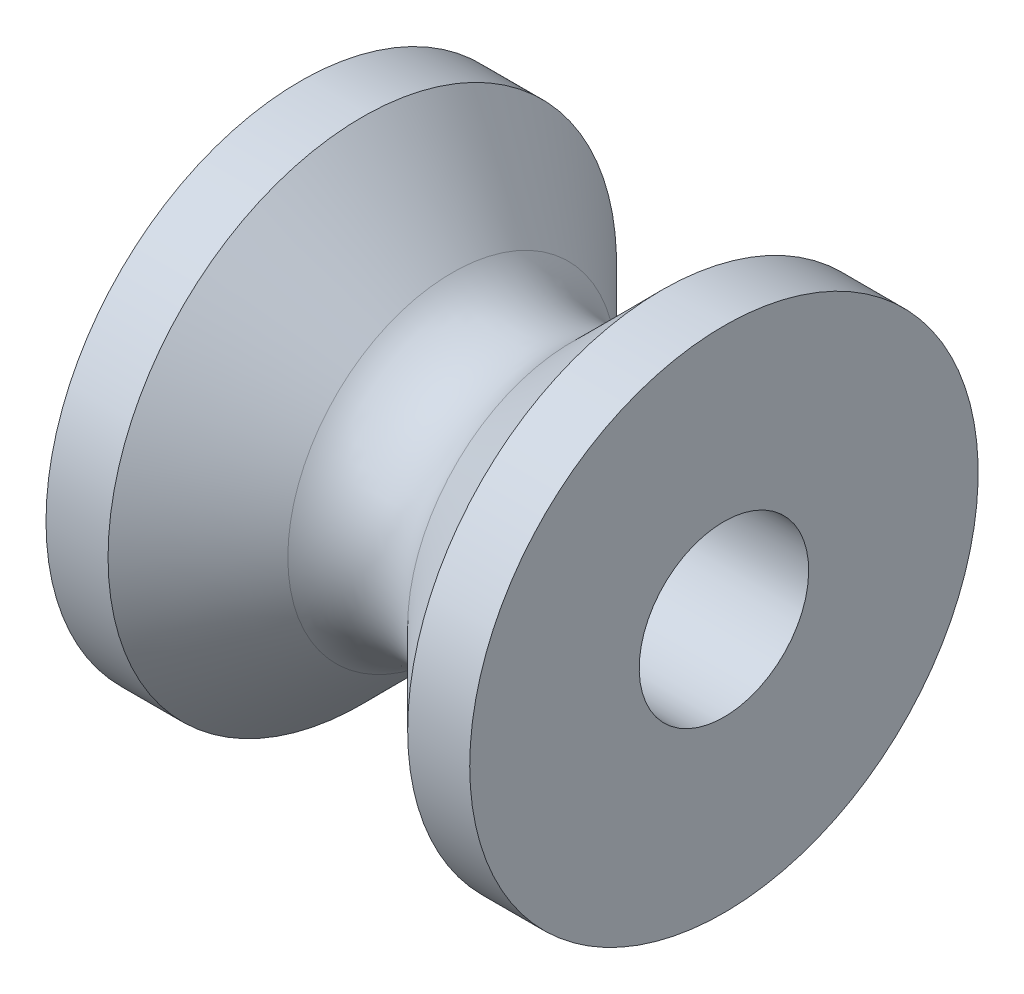
from build123d import *

# Parameters (mm, degrees)
SKETCH2_R          = 2
CUT_EXTRUDE3_DEPTH = 14.114877049
FILLET1_R          = 2


with BuildPart() as part:
    # Sketch1 → Revolve1 (revolve)
    with BuildSketch(Plane.XY):
        Polygon((0, 2.464466094), (3.535533906, 6), (5, 6), (5, 0), (-5, 0), (-5, 6), (-3.535533906, 6), align=None)
    revolve(axis=Axis((-5, 0, 0), (1, 0, 0)))

    # Sketch2 → Cut-Extrude3 (cut, through all)
    with BuildSketch(Plane(origin=(5, 0, 0), x_dir=(0, 0, -1), z_dir=(1, 0, 0))):
        Circle(SKETCH2_R)
    extrude(amount=-CUT_EXTRUDE3_DEPTH, mode=Mode.SUBTRACT)

    # Fillet1
    fillet1_edges = [part.edges().sort_by_distance(p)[0] for p in [
        (0, -2.464466094, 0),
    ]]
    fillet(fillet1_edges, radius=FILLET1_R)


solid = part.part
